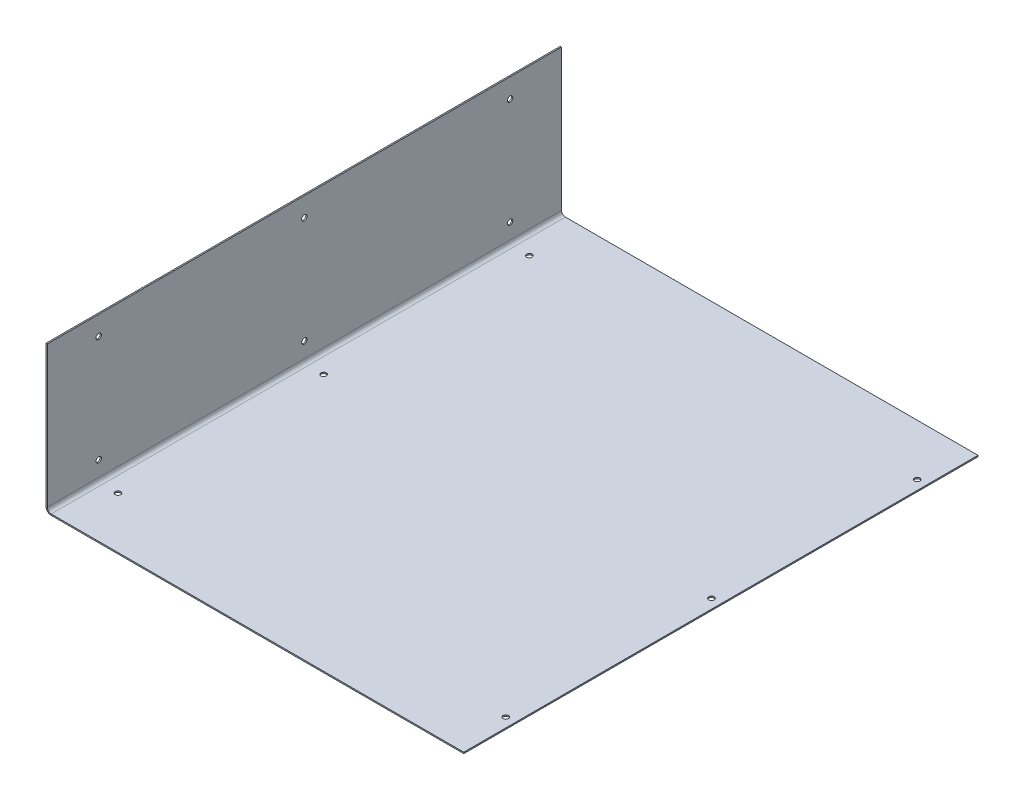
from build123d import *

# Parameters (mm, degrees)
SKETCH1_W                            = 400
SKETCH1_H                            = 114
BASE_FLANGE1_DEPTH                   = 1
EDGE_FLANGE1_STRIP_W                 = 10
EDGE_FLANGE1_STRIP_H                 = 1
EDGE_FLANGE1_STRIP_CUT_DEPTH         = 400
EDGE_FLANGE1_DEPTH                   = 400
F_4_2_START                          = -57
F_4_2_4_2_DIAMETER_HOLE1_OUTLINE_R   = 2.1
F_4_2_4_2_DIAMETER_HOLE1_DEPTH       = 1
F_4_2_START_2                        = -1
F_4_2_4_2_DIAMETER_HOLE1_2_OUTLINE_R = 2.1
F_4_2_4_2_DIAMETER_HOLE1_2_DEPTH     = 1


# Read off the part's stored shape, not the designer's step: Ø4.2 (4.2) Diameter Hole1
# Sheet-metal steps are written as plain solids
with BuildPart() as part:
    # Sketch1 → Base-Flange1 (new body)
    with BuildSketch(Plane(origin=(0, 0, 0), x_dir=(0, 0, -1), z_dir=(1, 0, 0))):
        Rectangle(SKETCH1_W, SKETCH1_H)
    extrude(amount=-BASE_FLANGE1_DEPTH)

    # Edge-Flange1 strip (across the edge) → Edge-Flange1 strip cut (cut)
    with BuildSketch(Plane(origin=(0, -57, 200), x_dir=(0, 1, 0), z_dir=(0, 0, -1))):
        with Locations((-1, -0.5)):
            Rectangle(EDGE_FLANGE1_STRIP_W, EDGE_FLANGE1_STRIP_H)
    extrude(amount=EDGE_FLANGE1_STRIP_CUT_DEPTH, mode=Mode.SUBTRACT)

    # Edge-Flange1 section (across the edge) → Edge-Flange1 (add)
    with BuildSketch(Plane(origin=(0, -57, 200), x_dir=(0, 1, 0), z_dir=(0, 0, -1))):
        with BuildLine():
            Line((0, 3), (0, 324))
            Line((0, 324), (1, 324))
            Line((1, 324), (1, 3))
            ThreePointArc((1, 3), (1.878679656, 0.878679656), (4, 0))
            Line((4, 0), (4, -1))
            ThreePointArc((4, -1), (1.171572875, 0.171572875), (0, 3))
        make_face()
    extrude(amount=EDGE_FLANGE1_DEPTH)

    # Ø4.2 (4.2) Diameter Hole1 outline → Ø4.2 (4.2) Diameter Hole1 (cut)
    with BuildSketch(Plane(origin=(0, 0, 0), x_dir=(1, 0, 0), z_dir=(0, 1, 0)).offset(F_4_2_START)):
        with Locations((15, 160)):
            Circle(F_4_2_4_2_DIAMETER_HOLE1_OUTLINE_R)
        with Locations((15, 0)):
            Circle(F_4_2_4_2_DIAMETER_HOLE1_OUTLINE_R)
        with Locations((15, -160)):
            Circle(F_4_2_4_2_DIAMETER_HOLE1_OUTLINE_R)
        with Locations((316.678974837, -160)):
            Circle(F_4_2_4_2_DIAMETER_HOLE1_OUTLINE_R)
        with Locations((316.678974837, 0)):
            Circle(F_4_2_4_2_DIAMETER_HOLE1_OUTLINE_R)
        with Locations((316.678974837, 160)):
            Circle(F_4_2_4_2_DIAMETER_HOLE1_OUTLINE_R)
    extrude(amount=F_4_2_4_2_DIAMETER_HOLE1_DEPTH, mode=Mode.SUBTRACT)

    # 4.2 _4.2_ Diameter Hole1 2 outline → 4.2 _4.2_ Diameter Hole1 2 (cut)
    with BuildSketch(Plane.YZ.offset(F_4_2_START_2)):
        with Locations((42, -160)):
            Circle(F_4_2_4_2_DIAMETER_HOLE1_2_OUTLINE_R)
        with Locations((42, 0)):
            Circle(F_4_2_4_2_DIAMETER_HOLE1_2_OUTLINE_R)
        with Locations((42, 160)):
            Circle(F_4_2_4_2_DIAMETER_HOLE1_2_OUTLINE_R)
        with Locations((-41, 160)):
            Circle(F_4_2_4_2_DIAMETER_HOLE1_2_OUTLINE_R)
        with Locations((-41, 0)):
            Circle(F_4_2_4_2_DIAMETER_HOLE1_2_OUTLINE_R)
        with Locations((-41, -160)):
            Circle(F_4_2_4_2_DIAMETER_HOLE1_2_OUTLINE_R)
    extrude(amount=F_4_2_4_2_DIAMETER_HOLE1_2_DEPTH, mode=Mode.SUBTRACT)


solid = part.part
